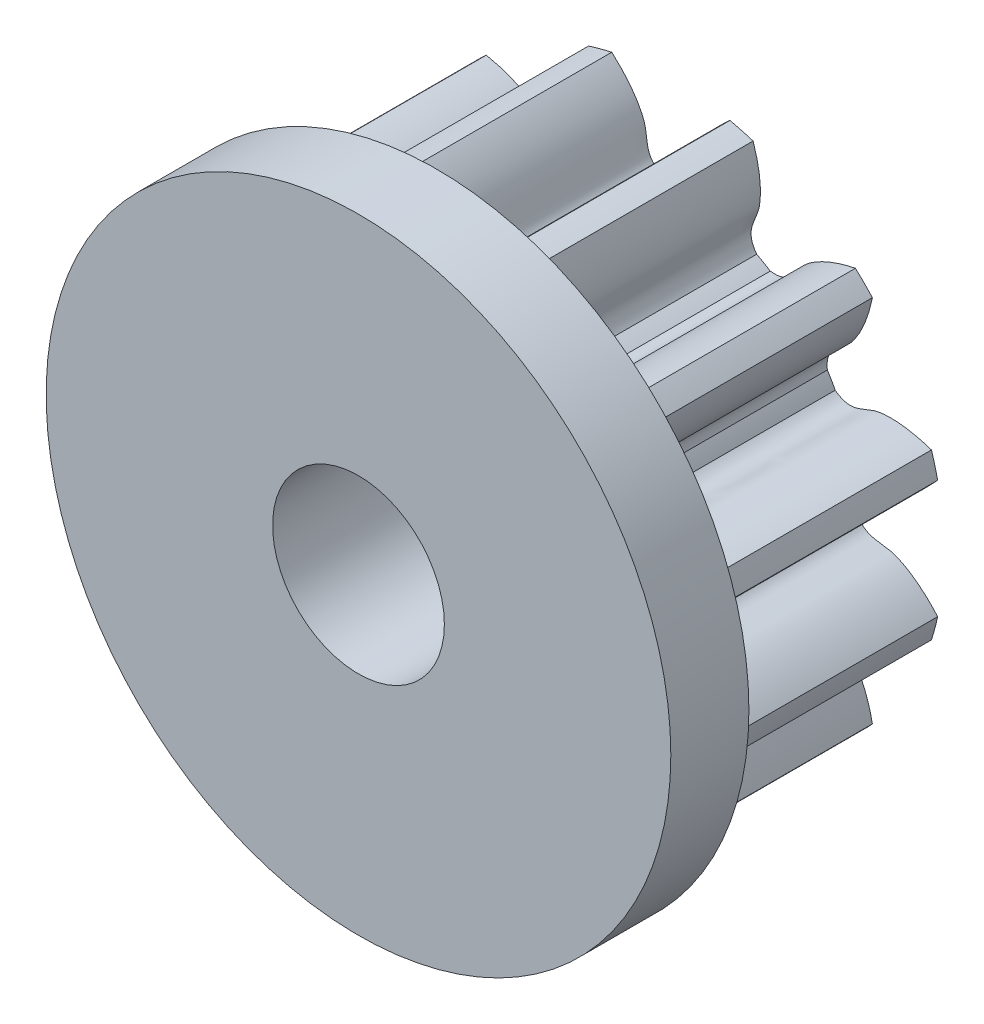
from build123d import *

# Parameters (mm, degrees)
SKETCH_1_R               = 3.5
EXTRUDE_1_DEPTH          = 3
CUT_EXTRUDE_1_DEPTH      = 6.787918451
PATTERN_CIRCULAR_1_COUNT = 12
SKETCH_5_R               = 4
EXTRUDE_2_DEPTH          = 1
SKETCH_6_R               = 1.1
CUT_EXTRUDE_2_DEPTH      = 10


with BuildPart() as part:
    # 草图1 → 凸台-拉伸1 (new body)
    with BuildSketch(Plane.XY):
        Circle(SKETCH_1_R)
    extrude(amount=EXTRUDE_1_DEPTH)

    # 草图2 → 切除-拉伸1 (cut, through all)
    with BuildSketch(Plane.XY):
        with BuildLine():
            ThreePointArc((0.100420056, 2.372876063), (0, 2.375), (-0.100420056, 2.372876063))
            add(Edge.make_bspline(
                [(-0.100420056, 2.372876063), (-0.340394435, 2.474653731), (-0.287186739, 2.672409341), (-0.338076094, 2.844740289), (-0.341311927, 2.854952869), (-0.345113625, 2.866166713), (-0.349521434, 2.878363044), (-0.354576313, 2.891521619), (-0.360318258, 2.905621034), (-0.36678678, 2.920638648), (-0.374020716, 2.936550626), (-0.382058239, 2.95333195), (-0.390936819, 2.970956436), (-0.400693193, 2.989396753), (-0.411363332, 3.008624444), (-0.422982412, 3.02860994), (-0.435584786, 3.049322589), (-0.449203949, 3.07073067), (-0.463872517, 3.092801417), (-0.479622192, 3.115501045), (-0.496483738, 3.138794769), (-0.514486952, 3.162646832), (-0.533660639, 3.187020528), (-0.554032585, 3.211878226), (-0.575629533, 3.237181399), (-0.598477155, 3.262890651), (-0.622600033, 3.288965742), (-0.648021632, 3.315365616), (-0.674764279, 3.342048434), (-0.702849139, 3.368971597), (-0.732296196, 3.396091781), (-0.763124233, 3.423364967), (-0.795350811, 3.450746465), (-0.828992247, 3.478190957), (-0.864063604, 3.505652518), (-0.900578664, 3.533084654), (-0.938549918, 3.560440334), (-0.977988547, 3.587672024), (-1.01890441, 3.614731718), (-1.061306025, 3.641570973), (-1.10520056, 3.668140947), (-1.150593819, 3.694392428), (-1.197490231, 3.720275872), (-1.245892835, 3.74574144), (-1.295803277, 3.770739031), (-1.347221796, 3.79521832), (-1.400147219, 3.819128792), (-1.454576948, 3.842419781), (-1.510506963, 3.865040505), (-1.567931802, 3.886940103), (-1.647189853, 3.915363979), (-1.7077968, 3.935050704), (-1.748802701, 3.947485455)],
                knots=[0, 0, 0, 0, 0.218015236, 0.222043642, 0.226545979, 0.231522246, 0.236972443, 0.24289657, 0.249294627, 0.256166614, 0.263512532, 0.271332379, 0.279626157, 0.288393865, 0.297635503, 0.307351072, 0.31754057, 0.328203999, 0.339341357, 0.350952646, 0.363037866, 0.375597015, 0.388630094, 0.402137104, 0.416118043, 0.430572913, 0.445501713, 0.460904444, 0.476781104, 0.493131694, 0.509956215, 0.527254666, 0.545027047, 0.563273358, 0.581993599, 0.601187771, 0.620855872, 0.640997904, 0.661613866, 0.682703758, 0.704267581, 0.726305333, 0.748817015, 0.771802628, 0.795262171, 0.819195644, 0.843603047, 0.868484381, 0.893839644, 0.919668838, 0.945971962, 1, 1, 1, 1], degree=3))
            ThreePointArc((-1.748802701, 3.947485455), (0, 4.317516914), (1.748802701, 3.947485455))
            add(Edge.make_bspline(
                [(0.100420056, 2.372876063), (0.340394435, 2.474653731), (0.287186739, 2.672409341), (0.338076094, 2.844740289), (0.341311927, 2.854952869), (0.345113625, 2.866166713), (0.349521434, 2.878363044), (0.354576313, 2.891521619), (0.360318258, 2.905621034), (0.36678678, 2.920638648), (0.374020716, 2.936550626), (0.382058239, 2.95333195), (0.390936819, 2.970956436), (0.400693193, 2.989396753), (0.411363332, 3.008624444), (0.422982412, 3.02860994), (0.435584786, 3.049322589), (0.449203949, 3.07073067), (0.463872517, 3.092801417), (0.479622192, 3.115501045), (0.496483738, 3.138794769), (0.514486952, 3.162646832), (0.533660639, 3.187020528), (0.554032585, 3.211878226), (0.575629533, 3.237181399), (0.598477155, 3.262890651), (0.622600033, 3.288965742), (0.648021632, 3.315365616), (0.674764279, 3.342048434), (0.702849139, 3.368971597), (0.732296196, 3.396091781), (0.763124233, 3.423364967), (0.795350811, 3.450746465), (0.828992247, 3.478190957), (0.864063604, 3.505652518), (0.900578664, 3.533084654), (0.938549918, 3.560440334), (0.977988547, 3.587672024), (1.01890441, 3.614731718), (1.061306025, 3.641570973), (1.10520056, 3.668140947), (1.150593819, 3.694392428), (1.197490231, 3.720275872), (1.245892835, 3.74574144), (1.295803277, 3.770739031), (1.347221796, 3.79521832), (1.400147219, 3.819128792), (1.454576948, 3.842419781), (1.510506963, 3.865040505), (1.567931802, 3.886940103), (1.647189853, 3.915363979), (1.7077968, 3.935050704), (1.748802701, 3.947485455)],
                knots=[0, 0, 0, 0, 0.218015236, 0.222043642, 0.226545979, 0.231522246, 0.236972443, 0.24289657, 0.249294627, 0.256166614, 0.263512532, 0.271332379, 0.279626157, 0.288393865, 0.297635503, 0.307351072, 0.31754057, 0.328203999, 0.339341357, 0.350952646, 0.363037866, 0.375597015, 0.388630094, 0.402137104, 0.416118043, 0.430572913, 0.445501713, 0.460904444, 0.476781104, 0.493131694, 0.509956215, 0.527254666, 0.545027047, 0.563273358, 0.581993599, 0.601187771, 0.620855872, 0.640997904, 0.661613866, 0.682703758, 0.704267581, 0.726305333, 0.748817015, 0.771802628, 0.795262171, 0.819195644, 0.843603047, 0.868484381, 0.893839644, 0.919668838, 0.945971962, 1, 1, 1, 1], degree=3))
        make_face()
    cut_extrude_1 = extrude(amount=CUT_EXTRUDE_1_DEPTH, mode=Mode.SUBTRACT)

    # 阵列(圆周)1: 切除-拉伸1 ×12 about axis
    pattern_circular_1_axis = Axis((0, 0, 3), (0, 0, -1))
    for i in range(1, PATTERN_CIRCULAR_1_COUNT):
        add(cut_extrude_1.rotate(pattern_circular_1_axis, i * 360 / PATTERN_CIRCULAR_1_COUNT), mode=Mode.SUBTRACT)

    # 草图5 → 凸台-拉伸2 (add)
    with BuildSketch(Plane.XY.offset(3)):
        Circle(SKETCH_5_R)
    extrude(amount=EXTRUDE_2_DEPTH)

    # 草图6 → 切除-拉伸2 (cut)
    with BuildSketch(Plane.XY.offset(4)):
        Circle(SKETCH_6_R)
    extrude(amount=-CUT_EXTRUDE_2_DEPTH, mode=Mode.SUBTRACT)


solid = part.part
